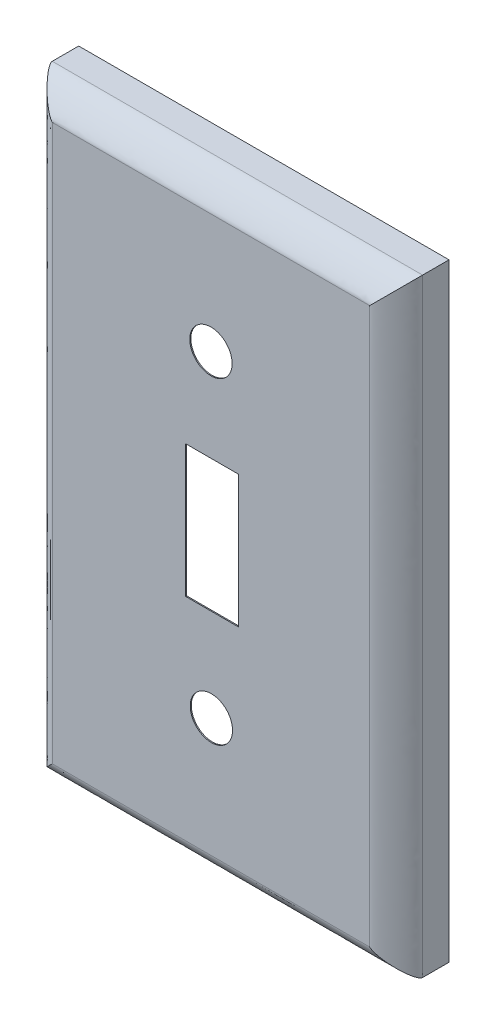
from build123d import *

# Parameters (mm, degrees)
SKETCH1_W           = 70
SKETCH1_H           = 115
BOSS_EXTRUDE1_DEPTH = 10
FILLET3_SIZE        = 5
SHELL1_T            = -0.2
SKETCH2_W           = 10
SKETCH2_H           = 25
CUT_EXTRUDE1_DEPTH  = 83.28323905
SKETCH3_R           = 4
CUT_EXTRUDE2_DEPTH  = 83.28323905


with BuildPart() as part:
    # Sketch1 → Boss-Extrude1 (new body)
    with BuildSketch(Plane.XY):
        with Locations((-0.078534031, -16.256544503)):
            Rectangle(SKETCH1_W, SKETCH1_H)
    extrude(amount=BOSS_EXTRUDE1_DEPTH)

    # Fillet3
    # a fillet whose section is not a circle: 5 mm, written as the material it takes off along each edge
    with BuildSketch(Plane(origin=(47.421465969, -73.756544503, 10), x_dir=(0, 0, -1), z_dir=(-1, 0, 0)), Plane(origin=(-47.578534031, 41.243455497, 10), x_dir=(0, 0, -1), z_dir=(1, 0, 0))) as fillet3_piece_1:
        with BuildLine():
            Bezier((FILLET3_SIZE, 0), (0, 0), (0, -FILLET3_SIZE), weights=[1, 0.25, 1])
            Line((0, -FILLET3_SIZE), (0, 0))
            Line((0, 0), (FILLET3_SIZE, 0))
        make_face()
    extrude(amount=95, mode=Mode.SUBTRACT)
    with BuildSketch(Plane(origin=(34.921465969, 53.743455497, 10), x_dir=(0, 0, -1), z_dir=(0, -1, 0)), Plane(origin=(-35.078534031, -86.256544503, 10), x_dir=(0, 0, -1), z_dir=(0, 1, 0))) as fillet3_piece_2:
        with BuildLine():
            Bezier((FILLET3_SIZE, 0), (0, 0), (0, -FILLET3_SIZE), weights=[1, 0.25, 1])
            Line((0, -FILLET3_SIZE), (0, 0))
            Line((0, 0), (FILLET3_SIZE, 0))
        make_face()
    extrude(amount=140, mode=Mode.SUBTRACT)

    # Shell1
    shell1_openings = [part.faces().sort_by_distance(p)[0] for p in [
        (-0.078534031, -16.256544503, 0),
    ]]
    offset(amount=SHELL1_T, openings=shell1_openings)

    # Sketch2 → Cut-Extrude1 (cut, through all)
    with BuildSketch(Plane.XY.offset(10)):
        with Locations((0.121465969, -16.256544503)):
            Rectangle(SKETCH2_W, SKETCH2_H)
    extrude(amount=-CUT_EXTRUDE1_DEPTH, mode=Mode.SUBTRACT)

    # Sketch3 → Cut-Extrude2 (cut, through all)
    with BuildSketch(Plane.XY.offset(10)):
        with Locations((-0.078534031, 13.743455497)):
            Circle(SKETCH3_R)
        with Locations((0, -46.256544503)):
            Circle(SKETCH3_R)
    extrude(amount=-CUT_EXTRUDE2_DEPTH, mode=Mode.SUBTRACT)


solid = part.part
